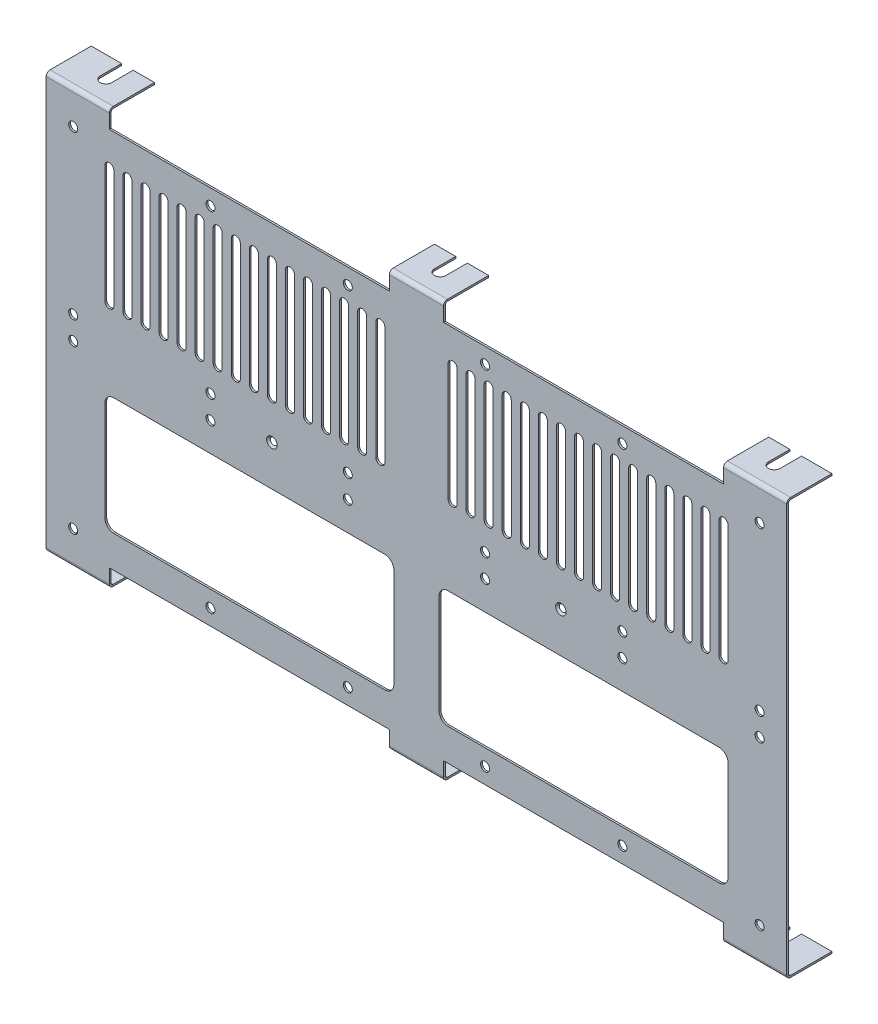
from build123d import *

# Parameters (mm, degrees)
SKETCH1_W                    = 475
SKETCH1_H                    = 124.24
BOSS_EXTRUDE1_DEPTH          = 1.02
EDGE_FLANGE1_STRIP_W         = 6.366
EDGE_FLANGE1_STRIP_H         = 1.02
EDGE_FLANGE1_STRIP_CUT_DEPTH = 475
EDGE_FLANGE1_DEPTH           = 475
EDGE_FLANGE2_STRIP_W         = 6.366
EDGE_FLANGE2_STRIP_H         = 1.02
EDGE_FLANGE2_STRIP_CUT_DEPTH = 475
EDGE_FLANGE2_DEPTH           = 475
CUT_EXTRUDE1_REACH           = 338.699
SKETCH15_W                   = 475
SKETCH15_H                   = 100.26
CUT_EXTRUDE2_DEPTH           = 331.962822081
CUT_EXTRUDE2_DEPTH_BACK      = 331.962822081
SKETCH16_W                   = 100
SKETCH16_H                   = 245
CUT_EXTRUDE3_DEPTH           = 314.873858739
CUT_EXTRUDE3_DEPTH_BACK      = 314.873858739
SKETCH17_R                   = 3.2
CUT_EXTRUDE4_DEPTH           = 314.873858739
CUT_EXTRUDE4_DEPTH_BACK      = 314.873858739
SKETCH18_W                   = 6.4
SKETCH18_H                   = 11.86
CUT_EXTRUDE5_DEPTH           = 315.61927023
CUT_EXTRUDE5_DEPTH_BACK      = 10
SKETCH19_W                   = 155
SKETCH19_H                   = 25
SKETCH20_W                   = 155
SKETCH20_H                   = 25
CUT_EXTRUDE6_DEPTH           = 10
CUT_EXTRUDE7_DEPTH           = 309.472267149
CUT_EXTRUDE7_DEPTH_BACK      = 309.472267149
CUT_EXTRUDE8_DEPTH           = 314.873858739
CUT_EXTRUDE9_DEPTH           = 314.873858739
CUT_EXTRUDE9_DEPTH_BACK      = 314.873858739
SKETCH24_R                   = 2.5
SKETCH24_R_2                 = 1.6
CHAMFER1_SIZE                = 1.3


# Sheet-metal steps are written as plain solids
with BuildPart() as part:
    # Sketch1 → Boss-Extrude1 (new body)
    with BuildSketch(Plane(origin=(0, 0, 0), x_dir=(1, 0, 0), z_dir=(0, 1, 0))):
        Rectangle(SKETCH1_W, SKETCH1_H)
    extrude(amount=BOSS_EXTRUDE1_DEPTH)

    # Edge-Flange1 strip (across the edge) → Edge-Flange1 strip cut (cut)
    with BuildSketch(Plane(origin=(237.5, 0, 62.12), x_dir=(0, 0, -1), z_dir=(-1, 0, 0))):
        with Locations((-2.04, -0.51)):
            Rectangle(EDGE_FLANGE1_STRIP_W, EDGE_FLANGE1_STRIP_H)
    extrude(amount=EDGE_FLANGE1_STRIP_CUT_DEPTH, mode=Mode.SUBTRACT)

    # Edge-Flange1 section (across the edge) → Edge-Flange1 (add)
    with BuildSketch(Plane(origin=(237.5, 0, 62.12), x_dir=(0, 0, -1), z_dir=(-1, 0, 0))):
        with BuildLine():
            Line((-1.02, 1.143), (-1.02, 228.12))
            Line((-1.02, 228.12), (0, 228.12))
            Line((0, 228.12), (0, 1.143))
            ThreePointArc((0, 1.143), (0.334776949, 0.334776949), (1.143, 0))
            Line((1.143, 0), (1.143, -1.02))
            ThreePointArc((1.143, -1.02), (-0.386471968, -0.386471968), (-1.02, 1.143))
        make_face()
    extrude(amount=EDGE_FLANGE1_DEPTH)

    # Edge-Flange2 strip (across the edge) → Edge-Flange2 strip cut (cut)
    with BuildSketch(Plane(origin=(237.5, -228.12, 62.12), x_dir=(0, 1, 0), z_dir=(-1, 0, 0))):
        with Locations((-2.04, -0.51)):
            Rectangle(EDGE_FLANGE2_STRIP_W, EDGE_FLANGE2_STRIP_H)
    extrude(amount=EDGE_FLANGE2_STRIP_CUT_DEPTH, mode=Mode.SUBTRACT)

    # Edge-Flange2 section (across the edge) → Edge-Flange2 (add)
    with BuildSketch(Plane(origin=(237.5, -228.12, 62.12), x_dir=(0, 1, 0), z_dir=(-1, 0, 0))):
        with BuildLine():
            Line((-1.02, 1.143), (-1.02, 23.98))
            Line((-1.02, 23.98), (0, 23.98))
            Line((0, 23.98), (0, 1.143))
            ThreePointArc((0, 1.143), (0.334776949, 0.334776949), (1.143, 0))
            Line((1.143, 0), (1.143, -1.02))
            ThreePointArc((1.143, -1.02), (-0.386471968, -0.386471968), (-1.02, 1.143))
        make_face()
    extrude(amount=EDGE_FLANGE2_DEPTH)

    # Sketch15 → Cut-Extrude1 (cut, up to next)
    with BuildSketch(Plane(origin=(0, 1.02, 0), x_dir=(1, 0, 0), z_dir=(0, 1, 0)), mode=Mode.PRIVATE) as cut_extrude1_sk1:
        with Locations((0, 11.99)):
            Rectangle(SKETCH15_W, SKETCH15_H)
    cut_extrude1_tool1 = extrude(cut_extrude1_sk1.sketch, amount=-CUT_EXTRUDE1_REACH, mode=Mode.PRIVATE) & part.part
    add(cut_extrude1_tool1.solids().sort_by_distance((0, 1.02, -11.99))[0], mode=Mode.SUBTRACT)

    # Sketch16 → Cut-Extrude2 (cut, two sides: drawn at the far end of the back side and taken through both)
    with BuildSketch(Plane.XY.offset(63.14).offset(-CUT_EXTRUDE2_DEPTH_BACK)):
        Polygon((-225, 5.94), (-275, 5.94), (-275, -239.06), (-225, -239.06), (-205, -239.06), (-205, 5.94), align=None)
        with Locations((255, -116.56)):
            Rectangle(SKETCH16_W, SKETCH16_H)
    extrude(amount=CUT_EXTRUDE2_DEPTH + CUT_EXTRUDE2_DEPTH_BACK, mode=Mode.SUBTRACT)

    # Sketch17 → Cut-Extrude3 (cut, two sides: drawn at the far end of the back side and taken through both)
    with BuildSketch(Plane(origin=(0, 0, 0), x_dir=(1, 0, 0), z_dir=(0, 1, 0)).offset(-CUT_EXTRUDE3_DEPTH_BACK)):
        with Locations((185, 50)):
            Circle(SKETCH17_R)
        with Locations((0, 50)):
            Circle(SKETCH17_R)
        with Locations((-185, 50)):
            Circle(SKETCH17_R)
        with Locations(Location((-185, -50, 0), (0, 0, 270))):
            Circle(SKETCH17_R)
        with Locations(Location((0, -50, 0), (0, 0, 270))):
            Circle(SKETCH17_R)
        with Locations(Location((185, -50, 0), (0, 0, 270))):
            Circle(SKETCH17_R)
    extrude(amount=CUT_EXTRUDE3_DEPTH + CUT_EXTRUDE3_DEPTH_BACK, mode=Mode.SUBTRACT)

    # Sketch18 → Cut-Extrude4 (cut, two sides: drawn at the far end of the back side and taken through both)
    with BuildSketch(Plane(origin=(0, 0, 0), x_dir=(1, 0, 0), z_dir=(0, 1, 0)).offset(-CUT_EXTRUDE4_DEPTH_BACK)):
        with Locations((0, -44.07)):
            Rectangle(SKETCH18_W, SKETCH18_H)
        with Locations((185, -44.07)):
            Rectangle(SKETCH18_W, SKETCH18_H)
        with Locations((-185, -44.07)):
            Rectangle(SKETCH18_W, SKETCH18_H)
    extrude(amount=CUT_EXTRUDE4_DEPTH + CUT_EXTRUDE4_DEPTH_BACK, mode=Mode.SUBTRACT)

    # Sketch19 → Cut-Extrude5 (cut, two sides: drawn at the far end of the back side and taken through both)
    with BuildSketch(Plane(origin=(0, 1.02, 0), x_dir=(1, 0, 0), z_dir=(0, 1, 0)).offset(-CUT_EXTRUDE5_DEPTH_BACK)):
        with Locations((-92.5, -50.64)):
            Rectangle(SKETCH19_W, SKETCH19_H)
        with Locations((92.5, -50.64)):
            Rectangle(SKETCH19_W, SKETCH19_H)
    extrude(amount=CUT_EXTRUDE5_DEPTH + CUT_EXTRUDE5_DEPTH_BACK, mode=Mode.SUBTRACT)

    # Sketch20 → Cut-Extrude6 (cut)
    with BuildSketch(Plane.XZ.offset(229.14)):
        with Locations((-92.5, 50.64)):
            Rectangle(SKETCH20_W, SKETCH20_H)
        with Locations((92.5, 50.64)):
            Rectangle(SKETCH20_W, SKETCH20_H)
    extrude(amount=-CUT_EXTRUDE6_DEPTH, mode=Mode.SUBTRACT)

    # Sketch21 → Cut-Extrude7 (cut, two sides: drawn at the far end of the back side and taken through both)
    with BuildSketch(Plane.XY.offset(63.14).offset(-CUT_EXTRUDE7_DEPTH_BACK)):
        with BuildLine():
            Line((-172.5, -92.426), (-172.5, -27.426))
            ThreePointArc((-172.5, -27.426), (-170, -24.926), (-167.5, -27.426))
            Line((-167.5, -27.426), (-167.5, -92.426))
            ThreePointArc((-167.5, -92.426), (-170, -94.926), (-172.5, -92.426))
        make_face()
        with BuildLine():
            Line((-157.5, -92.426), (-157.5, -27.426))
            ThreePointArc((-157.5, -27.426), (-160, -24.926), (-162.5, -27.426))
            Line((-162.5, -27.426), (-162.5, -92.426))
            ThreePointArc((-162.5, -92.426), (-160, -94.926), (-157.5, -92.426))
        make_face()
        with BuildLine():
            Line((-147.5, -92.426), (-147.5, -27.426))
            ThreePointArc((-147.5, -27.426), (-150, -24.926), (-152.5, -27.426))
            Line((-152.5, -27.426), (-152.5, -92.426))
            ThreePointArc((-152.5, -92.426), (-150, -94.926), (-147.5, -92.426))
        make_face()
        with BuildLine():
            Line((-137.5, -92.426), (-137.5, -27.426))
            ThreePointArc((-137.5, -27.426), (-140, -24.926), (-142.5, -27.426))
            Line((-142.5, -27.426), (-142.5, -92.426))
            ThreePointArc((-142.5, -92.426), (-140, -94.926), (-137.5, -92.426))
        make_face()
        with BuildLine():
            Line((-127.5, -92.426), (-127.5, -27.426))
            ThreePointArc((-127.5, -27.426), (-130, -24.926), (-132.5, -27.426))
            Line((-132.5, -27.426), (-132.5, -92.426))
            ThreePointArc((-132.5, -92.426), (-130, -94.926), (-127.5, -92.426))
        make_face()
        with BuildLine():
            Line((-117.5, -92.426), (-117.5, -27.426))
            ThreePointArc((-117.5, -27.426), (-120, -24.926), (-122.5, -27.426))
            Line((-122.5, -27.426), (-122.5, -92.426))
            ThreePointArc((-122.5, -92.426), (-120, -94.926), (-117.5, -92.426))
        make_face()
        with BuildLine():
            Line((-107.5, -92.426), (-107.5, -27.426))
            ThreePointArc((-107.5, -27.426), (-110, -24.926), (-112.5, -27.426))
            Line((-112.5, -27.426), (-112.5, -92.426))
            ThreePointArc((-112.5, -92.426), (-110, -94.926), (-107.5, -92.426))
        make_face()
        with BuildLine():
            Line((-97.5, -92.426), (-97.5, -27.426))
            ThreePointArc((-97.5, -27.426), (-100, -24.926), (-102.5, -27.426))
            Line((-102.5, -27.426), (-102.5, -92.426))
            ThreePointArc((-102.5, -92.426), (-100, -94.926), (-97.5, -92.426))
        make_face()
        with BuildLine():
            Line((-87.5, -92.426), (-87.5, -27.426))
            ThreePointArc((-87.5, -27.426), (-90, -24.926), (-92.5, -27.426))
            Line((-92.5, -27.426), (-92.5, -92.426))
            ThreePointArc((-92.5, -92.426), (-90, -94.926), (-87.5, -92.426))
        make_face()
        with BuildLine():
            Line((-77.5, -92.426), (-77.5, -27.426))
            ThreePointArc((-77.5, -27.426), (-80, -24.926), (-82.5, -27.426))
            Line((-82.5, -27.426), (-82.5, -92.426))
            ThreePointArc((-82.5, -92.426), (-80, -94.926), (-77.5, -92.426))
        make_face()
        with BuildLine():
            Line((-67.5, -92.426), (-67.5, -27.426))
            ThreePointArc((-67.5, -27.426), (-70, -24.926), (-72.5, -27.426))
            Line((-72.5, -27.426), (-72.5, -92.426))
            ThreePointArc((-72.5, -92.426), (-70, -94.926), (-67.5, -92.426))
        make_face()
        with BuildLine():
            Line((-57.5, -92.426), (-57.5, -27.426))
            ThreePointArc((-57.5, -27.426), (-60, -24.926), (-62.5, -27.426))
            Line((-62.5, -27.426), (-62.5, -92.426))
            ThreePointArc((-62.5, -92.426), (-60, -94.926), (-57.5, -92.426))
        make_face()
        with BuildLine():
            Line((-47.5, -92.426), (-47.5, -27.426))
            ThreePointArc((-47.5, -27.426), (-50, -24.926), (-52.5, -27.426))
            Line((-52.5, -27.426), (-52.5, -92.426))
            ThreePointArc((-52.5, -92.426), (-50, -94.926), (-47.5, -92.426))
        make_face()
        with BuildLine():
            Line((-37.5, -92.426), (-37.5, -27.426))
            ThreePointArc((-37.5, -27.426), (-40, -24.926), (-42.5, -27.426))
            Line((-42.5, -27.426), (-42.5, -92.426))
            ThreePointArc((-42.5, -92.426), (-40, -94.926), (-37.5, -92.426))
        make_face()
        with BuildLine():
            Line((-27.5, -92.426), (-27.5, -27.426))
            ThreePointArc((-27.5, -27.426), (-30, -24.926), (-32.5, -27.426))
            Line((-32.5, -27.426), (-32.5, -92.426))
            ThreePointArc((-32.5, -92.426), (-30, -94.926), (-27.5, -92.426))
        make_face()
        with BuildLine():
            Line((-17.5, -92.426), (-17.5, -27.426))
            ThreePointArc((-17.5, -27.426), (-20, -24.926), (-22.5, -27.426))
            Line((-22.5, -27.426), (-22.5, -92.426))
            ThreePointArc((-22.5, -92.426), (-20, -94.926), (-17.5, -92.426))
        make_face()
        with BuildLine():
            Line((22.5, -92.426), (22.5, -27.426))
            ThreePointArc((22.5, -27.426), (20, -24.926), (17.5, -27.426))
            Line((17.5, -27.426), (17.5, -92.426))
            ThreePointArc((17.5, -92.426), (20, -94.926), (22.5, -92.426))
        make_face()
        with BuildLine():
            Line((32.5, -92.426), (32.5, -27.426))
            ThreePointArc((32.5, -27.426), (30, -24.926), (27.5, -27.426))
            Line((27.5, -27.426), (27.5, -92.426))
            ThreePointArc((27.5, -92.426), (30, -94.926), (32.5, -92.426))
        make_face()
        with BuildLine():
            Line((42.5, -92.426), (42.5, -27.426))
            ThreePointArc((42.5, -27.426), (40, -24.926), (37.5, -27.426))
            Line((37.5, -27.426), (37.5, -92.426))
            ThreePointArc((37.5, -92.426), (40, -94.926), (42.5, -92.426))
        make_face()
        with BuildLine():
            Line((52.5, -92.426), (52.5, -27.426))
            ThreePointArc((52.5, -27.426), (50, -24.926), (47.5, -27.426))
            Line((47.5, -27.426), (47.5, -92.426))
            ThreePointArc((47.5, -92.426), (50, -94.926), (52.5, -92.426))
        make_face()
        with BuildLine():
            Line((62.5, -92.426), (62.5, -27.426))
            ThreePointArc((62.5, -27.426), (60, -24.926), (57.5, -27.426))
            Line((57.5, -27.426), (57.5, -92.426))
            ThreePointArc((57.5, -92.426), (60, -94.926), (62.5, -92.426))
        make_face()
        with BuildLine():
            Line((72.5, -92.426), (72.5, -27.426))
            ThreePointArc((72.5, -27.426), (70, -24.926), (67.5, -27.426))
            Line((67.5, -27.426), (67.5, -92.426))
            ThreePointArc((67.5, -92.426), (70, -94.926), (72.5, -92.426))
        make_face()
        with BuildLine():
            Line((82.5, -92.426), (82.5, -27.426))
            ThreePointArc((82.5, -27.426), (80, -24.926), (77.5, -27.426))
            Line((77.5, -27.426), (77.5, -92.426))
            ThreePointArc((77.5, -92.426), (80, -94.926), (82.5, -92.426))
        make_face()
        with BuildLine():
            Line((92.5, -92.426), (92.5, -27.426))
            ThreePointArc((92.5, -27.426), (90, -24.926), (87.5, -27.426))
            Line((87.5, -27.426), (87.5, -92.426))
            ThreePointArc((87.5, -92.426), (90, -94.926), (92.5, -92.426))
        make_face()
        with BuildLine():
            Line((102.5, -92.426), (102.5, -27.426))
            ThreePointArc((102.5, -27.426), (100, -24.926), (97.5, -27.426))
            Line((97.5, -27.426), (97.5, -92.426))
            ThreePointArc((97.5, -92.426), (100, -94.926), (102.5, -92.426))
        make_face()
        with BuildLine():
            Line((112.5, -92.426), (112.5, -27.426))
            ThreePointArc((112.5, -27.426), (110, -24.926), (107.5, -27.426))
            Line((107.5, -27.426), (107.5, -92.426))
            ThreePointArc((107.5, -92.426), (110, -94.926), (112.5, -92.426))
        make_face()
        with BuildLine():
            Line((122.5, -92.426), (122.5, -27.426))
            ThreePointArc((122.5, -27.426), (120, -24.926), (117.5, -27.426))
            Line((117.5, -27.426), (117.5, -92.426))
            ThreePointArc((117.5, -92.426), (120, -94.926), (122.5, -92.426))
        make_face()
        with BuildLine():
            Line((132.5, -92.426), (132.5, -27.426))
            ThreePointArc((132.5, -27.426), (130, -24.926), (127.5, -27.426))
            Line((127.5, -27.426), (127.5, -92.426))
            ThreePointArc((127.5, -92.426), (130, -94.926), (132.5, -92.426))
        make_face()
        with BuildLine():
            Line((142.5, -92.426), (142.5, -27.426))
            ThreePointArc((142.5, -27.426), (140, -24.926), (137.5, -27.426))
            Line((137.5, -27.426), (137.5, -92.426))
            ThreePointArc((137.5, -92.426), (140, -94.926), (142.5, -92.426))
        make_face()
        with BuildLine():
            Line((152.5, -92.426), (152.5, -27.426))
            ThreePointArc((152.5, -27.426), (150, -24.926), (147.5, -27.426))
            Line((147.5, -27.426), (147.5, -92.426))
            ThreePointArc((147.5, -92.426), (150, -94.926), (152.5, -92.426))
        make_face()
        with BuildLine():
            Line((162.5, -92.426), (162.5, -27.426))
            ThreePointArc((162.5, -27.426), (160, -24.926), (157.5, -27.426))
            Line((157.5, -27.426), (157.5, -92.426))
            ThreePointArc((157.5, -92.426), (160, -94.926), (162.5, -92.426))
        make_face()
        with BuildLine():
            Line((172.5, -92.426), (172.5, -27.426))
            ThreePointArc((172.5, -27.426), (170, -24.926), (167.5, -27.426))
            Line((167.5, -27.426), (167.5, -92.426))
            ThreePointArc((167.5, -92.426), (170, -94.926), (172.5, -92.426))
        make_face()
    extrude(amount=CUT_EXTRUDE7_DEPTH + CUT_EXTRUDE7_DEPTH_BACK, mode=Mode.SUBTRACT)

    # Sketch22 → Cut-Extrude8 (cut, through all)
    with BuildSketch(Plane.XY):
        with BuildLine():
            Line((-17.5, -201.41), (-167.5, -201.41))
            ThreePointArc((-167.5, -201.41), (-171.035533906, -199.945533906), (-172.5, -196.41))
            Line((-172.5, -196.41), (-172.5, -141.41))
            ThreePointArc((-172.5, -141.41), (-171.035533906, -137.874466094), (-167.5, -136.41))
            Line((-167.5, -136.41), (-17.5, -136.41))
            ThreePointArc((-17.5, -136.41), (-13.964466094, -137.874466094), (-12.5, -141.41))
            Line((-12.5, -141.41), (-12.5, -196.41))
            ThreePointArc((-12.5, -196.41), (-13.964466094, -199.945533906), (-17.5, -201.41))
        make_face()
        with BuildLine():
            Line((172.5, -196.41), (172.5, -141.41))
            ThreePointArc((172.5, -141.41), (171.035533906, -137.874466094), (167.5, -136.41))
            Line((167.5, -136.41), (17.5, -136.41))
            ThreePointArc((17.5, -136.41), (13.964466094, -137.874466094), (12.5, -141.41))
            Line((12.5, -141.41), (12.5, -196.41))
            ThreePointArc((12.5, -196.41), (13.964466094, -199.945533906), (17.5, -201.41))
            Line((17.5, -201.41), (167.5, -201.41))
            ThreePointArc((167.5, -201.41), (171.035533906, -199.945533906), (172.5, -196.41))
        make_face()
    extrude(amount=CUT_EXTRUDE8_DEPTH, mode=Mode.SUBTRACT)

    # Sketch24 → Cut-Extrude9 (cut, two sides: drawn at the far end of the back side and taken through both)
    with BuildSketch(Plane.XY.offset(-CUT_EXTRUDE9_DEPTH_BACK)):
        with Locations(Location((190, -17.68, 0), (0, 0, 90))):
            Circle(SKETCH24_R)
        with Locations(Location((114, -17.68, 0), (0, 0, 90))):
            Circle(SKETCH24_R)
        with Locations(Location((38, -17.68, 0), (0, 0, 90))):
            Circle(SKETCH24_R)
        with Locations(Location((-38, -17.68, 0), (0, 0, 90))):
            Circle(SKETCH24_R)
        with Locations(Location((-114, -17.68, 0), (0, 0, 90))):
            Circle(SKETCH24_R)
        with Locations(Location((-190, -17.68, 0), (0, 0, 90))):
            Circle(SKETCH24_R)
        with Locations(Location((-190, -107.68, 0), (0, 0, 90))):
            Circle(SKETCH24_R)
        with Locations(Location((-190, -120.44, 0), (0, 0, 90))):
            Circle(SKETCH24_R)
        with Locations(Location((-114, -107.68, 0), (0, 0, 90))):
            Circle(SKETCH24_R)
        with Locations(Location((-114, -120.44, 0), (0, 0, 90))):
            Circle(SKETCH24_R)
        with Locations(Location((-38, -107.68, 0), (0, 0, 90))):
            Circle(SKETCH24_R)
        with Locations(Location((-38, -120.44, 0), (0, 0, 90))):
            Circle(SKETCH24_R)
        with Locations(Location((38, -107.68, 0), (0, 0, 90))):
            Circle(SKETCH24_R)
        with Locations(Location((38, -120.44, 0), (0, 0, 90))):
            Circle(SKETCH24_R)
        with Locations(Location((114, -107.68, 0), (0, 0, 90))):
            Circle(SKETCH24_R)
        with Locations(Location((114, -120.44, 0), (0, 0, 90))):
            Circle(SKETCH24_R)
        with Locations(Location((190, -107.68, 0), (0, 0, 90))):
            Circle(SKETCH24_R)
        with Locations(Location((190, -120.44, 0), (0, 0, 90))):
            Circle(SKETCH24_R)
        with Locations(Location((190, -210.44, 0), (0, 0, 90))):
            Circle(SKETCH24_R)
        with Locations(Location((114, -210.44, 0), (0, 0, 90))):
            Circle(SKETCH24_R)
        with Locations(Location((38, -210.44, 0), (0, 0, 90))):
            Circle(SKETCH24_R)
        with Locations(Location((-38, -210.44, 0), (0, 0, 90))):
            Circle(SKETCH24_R)
        with Locations(Location((-114, -210.44, 0), (0, 0, 90))):
            Circle(SKETCH24_R)
        with Locations(Location((-190, -210.44, 0), (0, 0, 90))):
            Circle(SKETCH24_R)
        with Locations(Location((-80, -114.06, 0), (0, 0, 90))):
            Circle(SKETCH24_R_2)
        with Locations(Location((80, -114.06, 0), (0, 0, 90))):
            Circle(SKETCH24_R_2)
    extrude(amount=CUT_EXTRUDE9_DEPTH + CUT_EXTRUDE9_DEPTH_BACK, mode=Mode.SUBTRACT)

    # Chamfer1
    # the kernel refuses this chamfer: 1.3 mm, written as the material it takes off along each edge
    with BuildSketch(Plane(origin=(80, -114.06, 63.14), x_dir=(0, 1, 0), z_dir=(-1, 0, 0))) as chamfer1_piece_1:
        Polygon((1.6 + CHAMFER1_SIZE, 0), (1.6, CHAMFER1_SIZE), (1.6, 0), align=None)
    revolve(axis=Axis((80, -114.06, 63.14), (0, 0, -1)), mode=Mode.SUBTRACT)
    with BuildSketch(Plane(origin=(-80, -114.06, 63.14), x_dir=(0, 1, 0), z_dir=(-1, 0, 0))) as chamfer1_piece_2:
        Polygon((1.6 + CHAMFER1_SIZE, 0), (1.6, CHAMFER1_SIZE), (1.6, 0), align=None)
    revolve(axis=Axis((-80, -114.06, 63.14), (0, 0, -1)), mode=Mode.SUBTRACT)


solid = part.part
